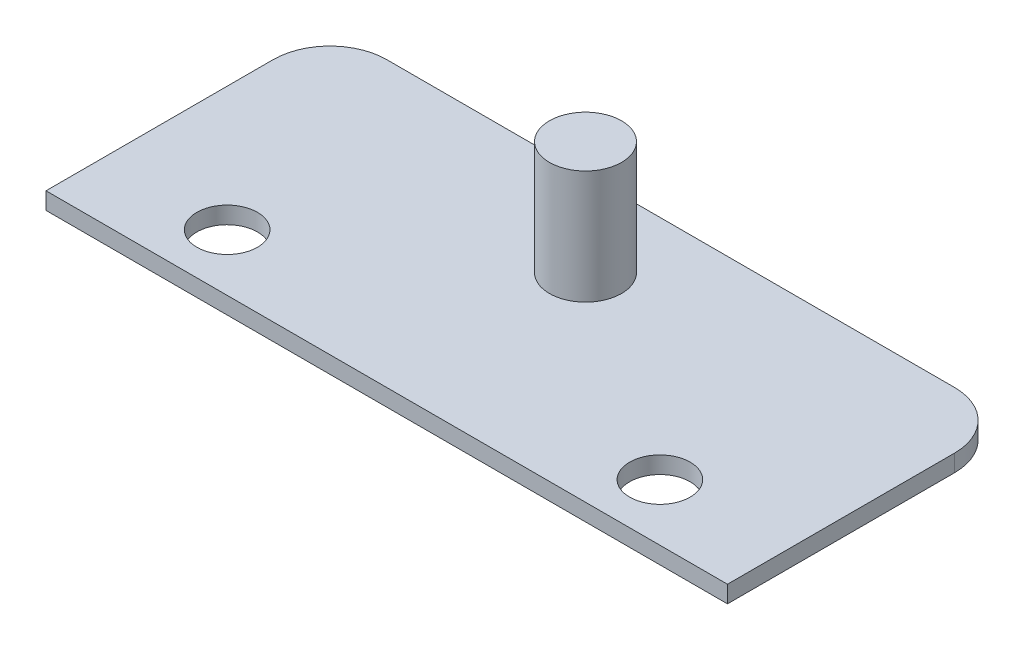
from build123d import *

# Parameters (mm, degrees)
SKETCH1_W           = 120
SKETCH1_H           = 50
BOSS_EXTRUDE1_DEPTH = 3
SKETCH2_R           = 5.334
CUT_EXTRUDE1_DEPTH  = 131.034610777
SKETCH3_R           = 6.35
BOSS_EXTRUDE2_DEPTH = 20
FILLET1_R           = 10


with BuildPart() as part:
    # Sketch1 → Boss-Extrude1 (new body)
    with BuildSketch(Plane(origin=(0, 0, 0), x_dir=(1, 0, 0), z_dir=(0, 1, 0))):
        with Locations((60, 25)):
            Rectangle(SKETCH1_W, SKETCH1_H)
    extrude(amount=BOSS_EXTRUDE1_DEPTH)

    # Sketch2 → Cut-Extrude1 (cut, through all)
    with BuildSketch(Plane(origin=(0, 3, 0), x_dir=(1, 0, 0), z_dir=(0, 1, 0))):
        with Locations((21.9, 10)):
            Circle(SKETCH2_R)
        with Locations((98.1, 10)):
            Circle(SKETCH2_R)
    extrude(amount=-CUT_EXTRUDE1_DEPTH, mode=Mode.SUBTRACT)

    # Sketch3 → Boss-Extrude2 (add)
    with BuildSketch(Plane(origin=(0, 3, 0), x_dir=(1, 0, 0), z_dir=(0, 1, 0))):
        with Locations((60, 35)):
            Circle(SKETCH3_R)
    extrude(amount=BOSS_EXTRUDE2_DEPTH)

    # Fillet1
    fillet1_edges = [part.edges().sort_by_distance(p)[0] for p in [
        (120, 1.5, -50),
        (0, 1.5, -50),
    ]]
    fillet(fillet1_edges, radius=FILLET1_R)


solid = part.part
